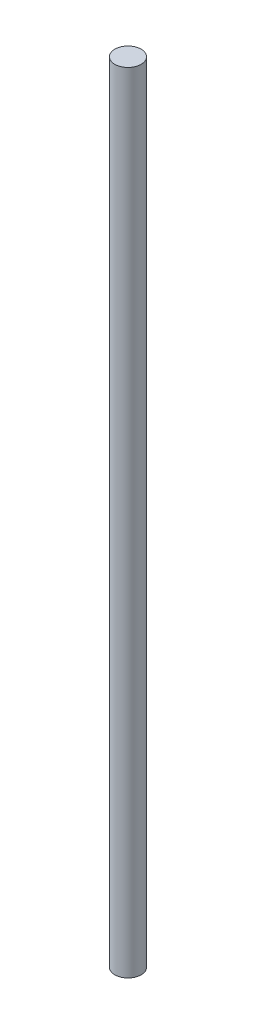
from build123d import *

# Parameters (mm, degrees)
SKETCH1_R           = 0.25
BOSS_EXTRUDE1_DEPTH = 7.5


with BuildPart() as part:
    # Sketch1 → Boss-Extrude1 (new, symmetric)
    with BuildSketch(Plane(origin=(0, 0, 0), x_dir=(1, 0, 0), z_dir=(0, 1, 0))):
        Circle(SKETCH1_R)
    extrude(amount=BOSS_EXTRUDE1_DEPTH, both=True)


solid = part.part
